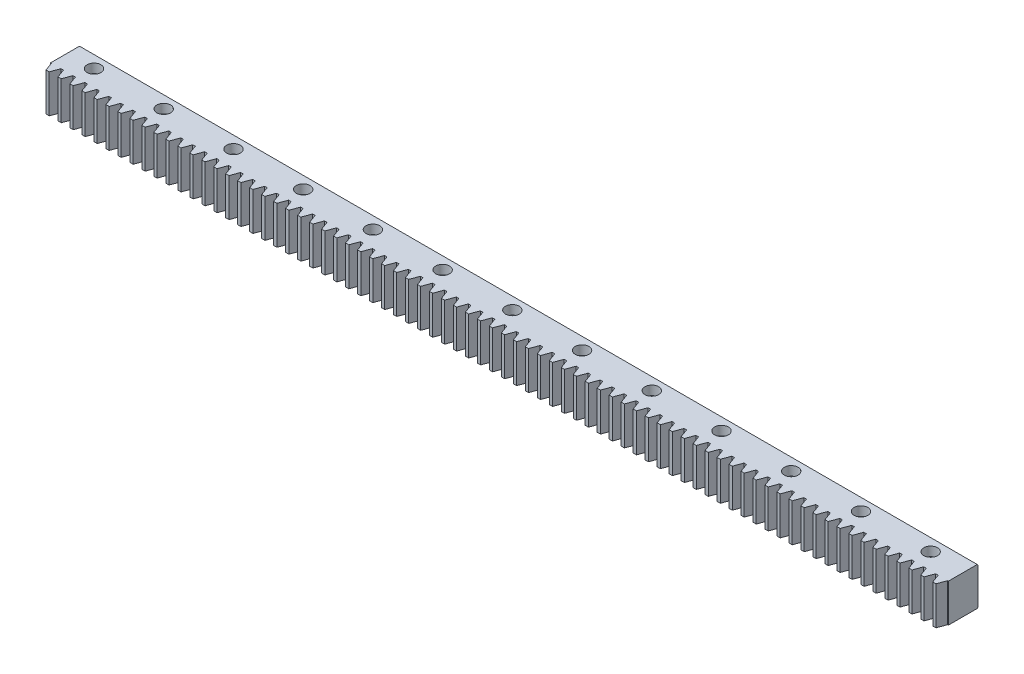
from build123d import *

# Parameters (mm, degrees)
SKETCH_1_W                    = 1176.7901
SKETCH_1_H                    = 50
EXTRUDE_1_DEPTH               = 25
CUT_EXTRUDE_START             = -50
CUT_EXTRUDE_1_DEPTH           = 50
PATTERN_LINEAR_1_COUNT        = 76
PATTERN_LINEAR_1_PITCH        = 15.707963267
CHAMFER_1_SIZE                = 1
HOLE_WIZARD_M10_1_D           = 11
HOLE_WIZARD_M10_1_CBORE_D     = 18
HOLE_WIZARD_M10_1_CBORE_DEPTH = 12
PATTERN_LINEAR_2_COUNT        = 13
PATTERN_LINEAR_2_PITCH        = 91.392


with BuildPart() as part:
    # 草圖1 → 伸長1 (new, symmetric)
    with BuildSketch(Plane(origin=(0, 0, 0), x_dir=(1, 0, 0), z_dir=(0, 1, 0))):
        with Locations((0, -25)):
            Rectangle(SKETCH_1_W, SKETCH_1_H)
    extrude(amount=EXTRUDE_1_DEPTH, both=True)

    # 草圖2 → 除料-伸長1 (cut)
    with BuildSketch(Plane(origin=(0, 25, 0), x_dir=(1, 0, 0), z_dir=(0, 1, 0)).offset(CUT_EXTRUDE_START)):
        Polygon((583.303208012, -50), (587.397873147, -38.75), (590.702226853, -38.75), (594.796891988, -50), align=None)
    cut_extrude_1 = extrude(amount=CUT_EXTRUDE_1_DEPTH, mode=Mode.SUBTRACT)

    # 直線複製排列1: 除料-伸長1 ×76
    with Locations(*[(-i * PATTERN_LINEAR_1_PITCH, 0, 0) for i in range(1, PATTERN_LINEAR_1_COUNT)]):
        add(cut_extrude_1, mode=Mode.SUBTRACT)

    # 導角1
    chamfer_1_edges = [part.edges().sort_by_distance(p)[0] for p in [
        (0, 25, 0),
        (0, -25, 0),
    ]]
    chamfer(chamfer_1_edges, length=CHAMFER_1_SIZE)

    # M10 六角承窩頭蓋螺釘的柱孔1 (through all)
    with Locations(Plane(origin=(0, 25, 0), x_dir=(-1, 0, 0), z_dir=(0, 1, 0))):
        with Locations((-543.35505, 17)):
            hole_wizard_m10_1 = CounterBoreHole(HOLE_WIZARD_M10_1_D / 2, HOLE_WIZARD_M10_1_CBORE_D / 2, HOLE_WIZARD_M10_1_CBORE_DEPTH)

    # 直線複製排列2: M10 六角承窩頭蓋螺釘的柱孔1 ×13
    with Locations(*[(-i * PATTERN_LINEAR_2_PITCH, 0, 0) for i in range(1, PATTERN_LINEAR_2_COUNT)]):
        add(hole_wizard_m10_1, mode=Mode.SUBTRACT)


solid = part.part
